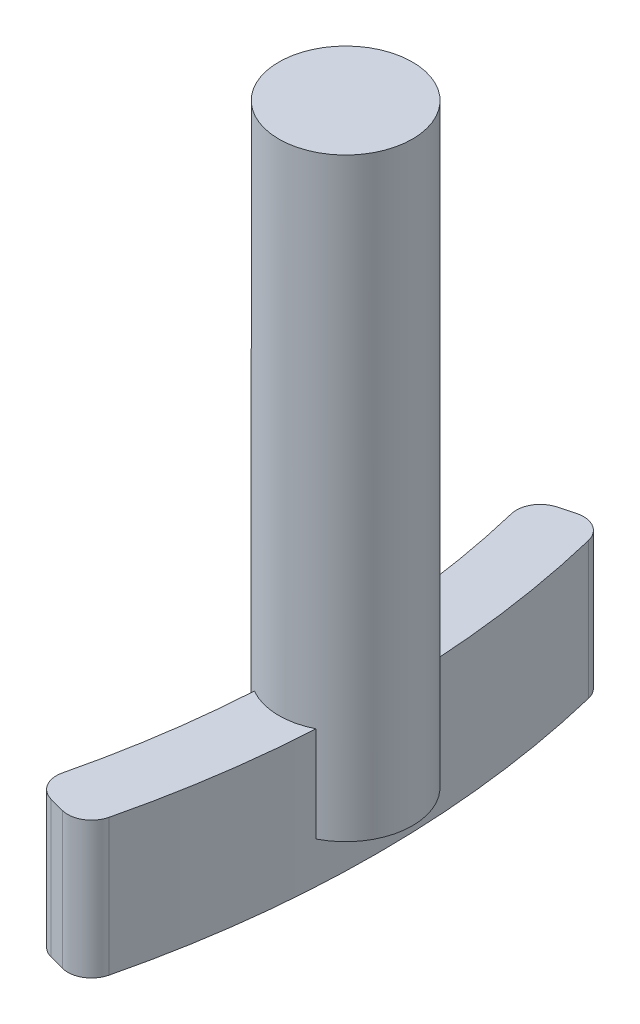
from build123d import *

# Parameters (mm, degrees)
EXTRUDE_1_DEPTH = 4.3
SKETCH_2_R      = 2.1
EXTRUDE_2_DEPTH = 18.7


with BuildPart() as part:
    # Эскиз1 → Бобышка-Вытянуть1 (new body)
    with BuildSketch(Plane(origin=(0, 0, 0), x_dir=(1, 0, 0), z_dir=(0, 1, 0))):
        with BuildLine():
            Line((-0.875365564, -7.956318037), (-0.392261233, -8.085765453))
            ThreePointArc((-0.392261233, -8.085765453), (0.184620836, -8.006293038), (0.530747493, -7.537992789))
            ThreePointArc((0.530747493, -7.537992789), (1.43125128, 0), (0.530747493, 7.537992789))
            ThreePointArc((0.530747493, 7.537992789), (0.184620836, 8.006293038), (-0.392261233, 8.085765453))
            Line((-0.392261233, 8.085765453), (-0.875365564, 7.956318037))
            ThreePointArc((-0.875365564, 7.956318037), (-1.326148514, 7.614767331), (-1.410214632, 7.055486505))
            ThreePointArc((-1.410214632, 7.055486505), (-0.56874872, 0), (-1.410214632, -7.055486505))
            ThreePointArc((-1.410214632, -7.055486505), (-1.326148514, -7.614767331), (-0.875365564, -7.956318037))
        make_face()
    extrude(amount=EXTRUDE_1_DEPTH)

    # Эскиз2 → Бобышка-Вытянуть2 (add)
    with BuildSketch(Plane(origin=(0, 1.3, 0), x_dir=(1, 0, 0), z_dir=(0, 1, 0))):
        with Locations((0.43125128, 0)):
            Circle(SKETCH_2_R)
    extrude(amount=EXTRUDE_2_DEPTH)


solid = part.part
